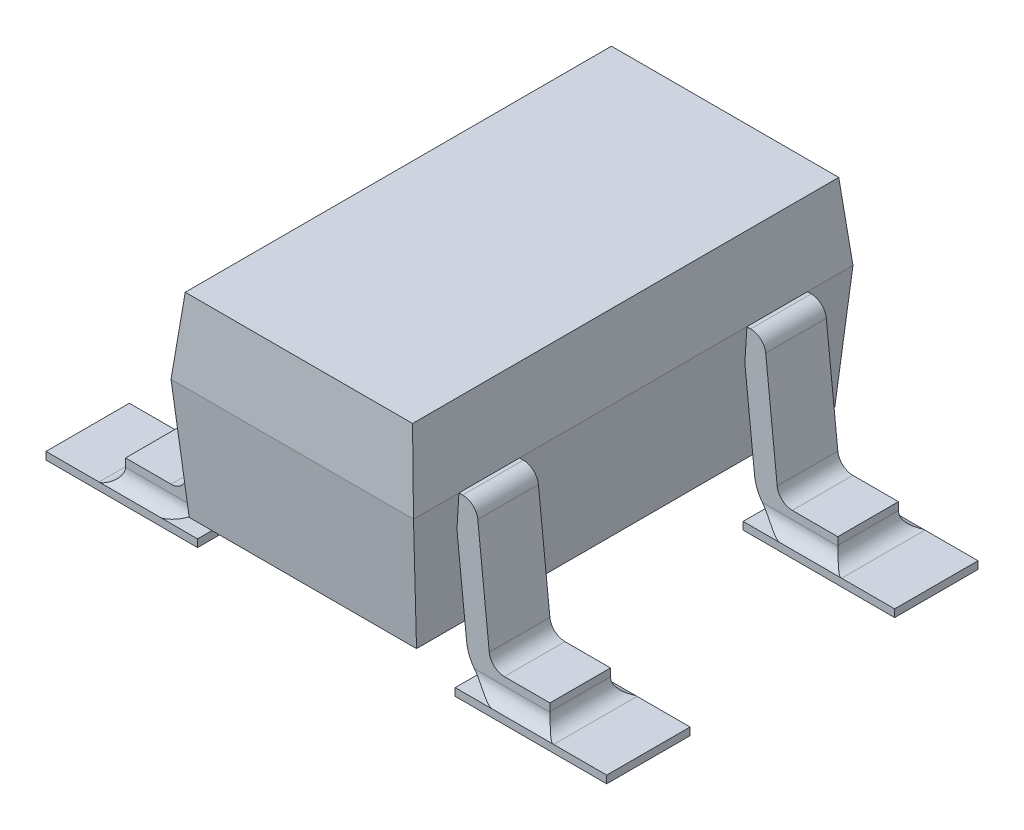
from build123d import *

# Parameters (mm, degrees)
BOSS_EXTRUDE1_DEPTH     = 1.45
CUT_EXTRUDE1_DEPTH      = 3.168524844
CUT_EXTRUDE1_DEPTH_BACK = 3.168524844
EXTRUDE_THIN1_DEPTH     = 0.2
SKETCH5_W               = 1
SKETCH5_H               = 0.55
BOSS_EXTRUDE2_DEPTH     = 0.05
FILLET1_START           = -1.4
FILLET1_DEPTH           = 0.326027692
FILLET1_START_2         = -1.073972308
FILLET1_2_DEPTH         = 0.17209879
FILLET1_START_3         = -1.5000001
FILLET1_3_DEPTH         = 0.1000001
FILLET1_4_DEPTH         = 2
FILLET1_START_4         = 0.75
FILLET1_5_DEPTH         = 0.4
FILLET2_START           = 1.079868081
FILLET2_DEPTH           = 0.320131919
FILLET2_START_2         = 0.901873518
FILLET2_2_DEPTH         = 0.177994563
FILLET2_START_3         = 1.4
FILLET2_3_DEPTH         = 0.1000001
FILLET2_4_DEPTH         = 2
FILLET2_START_4         = 0.75
FILLET2_5_DEPTH         = 0.4
LPATTERN1_COUNT         = 3
LPATTERN1_PITCH         = 0.95
CUT_EXTRUDE2_DEPTH      = 3.735872804
CUT_EXTRUDE2_DEPTH_BACK = 3.735872804
SKETCH6_W               = 1.85
SKETCH6_H               = 0.55
INDENT1_START           = -1.15
INDENT1_DEPTH           = 0.4
INDENT1_START_2         = 0.75
INDENT1_2_DEPTH         = 0.4
INDENT1_START_3         = -0.2
INDENT1_3_DEPTH         = 0.4


with BuildPart() as part:
    # Sketch1 → Boss-Extrude1 (new, symmetric)
    with BuildSketch(Plane.XY):
        Polygon((-0.75, 0.1), (0.75, 0.1), (0.8, 0.9), (0.75, 1.4), (-0.75, 1.4), (-0.8, 0.9), align=None)
    extrude(amount=BOSS_EXTRUDE1_DEPTH, both=True)

    # Sketch3 → Cut-Extrude1 (cut, two sides: drawn at the far end of the back side and taken through both)
    with BuildSketch(Plane(origin=(0, 0, 0), x_dir=(0, 0, -1), z_dir=(1, 0, 0)).offset(-CUT_EXTRUDE1_DEPTH_BACK)):
        Polygon((-1.45, 0.1), (-1.45, 0.9), (-1.380009069, 0.1), align=None)
        Polygon((-1.406255668, 1.4), (-1.45, 1.4), (-1.45, 0.9), align=None)
        Polygon((1.45, 0.9), (1.406255668, 1.4), (1.45, 1.4), align=None)
        Polygon((1.45, 0.9), (1.380009069, 0.1), (1.45, 0.1), align=None)
    extrude(amount=CUT_EXTRUDE1_DEPTH + CUT_EXTRUDE1_DEPTH_BACK, mode=Mode.SUBTRACT)

    # Indent1: read off the stored shape, not the designer's step
    # Indent1 outline → Indent1 (cut)
    with BuildSketch(Plane.XY.offset(INDENT1_START)):
        Polygon((-0.786572435, 0.685158958), (-0.779757367, 0.75), (0.779757367, 0.75), (0.786572435, 0.685158958), (0.8, 0.9), (-0.8, 0.9), align=None)
    extrude(amount=INDENT1_DEPTH, mode=Mode.SUBTRACT)

    # Indent1 2 outline → Indent1 2 (cut)
    with BuildSketch(Plane.XY.offset(INDENT1_START_2)):
        Polygon((-0.786572435, 0.685158958), (-0.779757367, 0.75), (0.779757367, 0.75), (0.786572435, 0.685158958), (0.8, 0.9), (-0.8, 0.9), align=None)
    extrude(amount=INDENT1_2_DEPTH, mode=Mode.SUBTRACT)

    # Indent1 3 outline → Indent1 3 (cut)
    with BuildSketch(Plane.XY.offset(INDENT1_START_3)):
        Polygon((-0.786572435, 0.685158958), (-0.779757367, 0.75), (0, 0.75), (0, 0.9), (-0.8, 0.9), align=None)
    extrude(amount=INDENT1_3_DEPTH, mode=Mode.SUBTRACT)


with BuildPart() as body_2:
    # Sketch4 → Extrude-Thin1 (new, symmetric)
    with BuildSketch(Plane.XY.offset(0.95)):
        with BuildLine():
            Line((-1.4, 0), (-1.09945219, 0))
            ThreePointArc((-1.09945219, 0), (-1.032539129, 0.025685517), (-1, 0.089547154))
            Line((-1, 0.089547154), (-0.924229758, 0.810452846))
            ThreePointArc((-0.924229758, 0.810452846), (-0.89169063, 0.874314483), (-0.824777569, 0.9))
            Line((-0.824777569, 0.9), (0.824777569, 0.9))
            ThreePointArc((0.824777569, 0.9), (0.89169063, 0.874314483), (0.924229758, 0.810452846))
            Line((0.924229758, 0.810452846), (1, 0.089547154))
            ThreePointArc((1, 0.089547154), (1.032539129, 0.025685517), (1.09945219, 0))
            Line((1.09945219, 0), (1.4, 0))
            Line((1.4, 0), (1.4, -0.15))
            Line((1.4, -0.15), (1.09945219, -0.15))
            ThreePointArc((1.09945219, -0.15), (0.932169538, -0.085786206), (0.850821716, 0.073867884))
            Line((0.850821716, 0.073867884), (0.779757367, 0.75))
            Line((0.779757367, 0.75), (-0.779757367, 0.75))
            Line((-0.779757367, 0.75), (-0.850821716, 0.073867884))
            ThreePointArc((-0.850821716, 0.073867884), (-0.932169538, -0.085786206), (-1.09945219, -0.15))
            Line((-1.09945219, -0.15), (-1.4, -0.15))
            Line((-1.4, -0.15), (-1.4, 0))
        make_face()
    extrude(amount=EXTRUDE_THIN1_DEPTH, both=True)

    # Sketch5 → Boss-Extrude2 (add)
    with BuildSketch(Plane.XZ.offset(0.15)):
        with Locations((-1.35, 0.95)):
            Rectangle(SKETCH5_W, SKETCH5_H)
        with Locations((1.35, 0.95)):
            Rectangle(SKETCH5_W, SKETCH5_H)
    extrude(amount=BOSS_EXTRUDE2_DEPTH)

    # Fillet1: read off the stored shape, not the designer's step
    # Fillet1 outline → Fillet1 (add)
    with BuildSketch(Plane.YZ.offset(FILLET1_START)):
        with BuildLine():
            Line((-0.053175416, 0.75), (-0.15, 0.75))
            Line((-0.15, 0.75), (-0.15000146, 0.674994344))
            ThreePointArc((-0.15000146, 0.674994344), (-0.114414969, 0.729055153), (-0.053175416, 0.75))
        make_face()
        with BuildLine():
            ThreePointArc((-0.053175416, 1.15), (-0.114414364, 1.170944378), (-0.150001077, 1.225004173))
            Line((-0.150001077, 1.225004173), (-0.15, 1.15))
            Line((-0.15, 1.15), (-0.053175416, 1.15))
        make_face()
    extrude(amount=FILLET1_DEPTH)

    # Fillet1 2 outline → Fillet1 2 (add)
    with BuildSketch(Plane.YZ.offset(FILLET1_START_2)):
        with BuildLine():
            ThreePointArc((-0.053175416, 1.15), (-0.114414364, 1.170944378), (-0.150001077, 1.225004173))
            Line((-0.150001077, 1.225004173), (-0.15, 1.15))
            Line((-0.15, 1.15), (-0.053175416, 1.15))
        make_face()
        with BuildLine():
            Line((-0.053175416, 0.75), (-0.15, 0.75))
            Line((-0.15, 0.75), (-0.15000146, 0.674994344))
            ThreePointArc((-0.15000146, 0.674994344), (-0.114414969, 0.729055153), (-0.053175416, 0.75))
        make_face()
    extrude(amount=FILLET1_2_DEPTH)

    # Fillet1 3 outline → Fillet1 3 (add)
    with BuildSketch(Plane.YZ.offset(FILLET1_START_3)):
        with BuildLine():
            ThreePointArc((-0.053175416, 1.15), (-0.114414364, 1.170944378), (-0.150001077, 1.225004173))
            Line((-0.150001077, 1.225004173), (-0.15, 1.15))
            Line((-0.15, 1.15), (-0.053175416, 1.15))
        make_face()
        with BuildLine():
            Line((-0.053175416, 0.75), (-0.15, 0.75))
            Line((-0.15, 0.75), (-0.15000146, 0.674994344))
            ThreePointArc((-0.15000146, 0.674994344), (-0.114414969, 0.729055153), (-0.053175416, 0.75))
        make_face()
    extrude(amount=FILLET1_3_DEPTH)

    # Fillet1 4 outline → Fillet1 4 (cut)
    with BuildSketch(Plane.XY):
        with BuildLine():
            ThreePointArc((-0.901873581, -0.053175367), (-0.989438195, -0.124492585), (-1.09945219, -0.15))
            Line((-1.09945219, -0.15), (-0.901873518, -0.15))
            Line((-0.901873518, -0.15), (-0.901873581, -0.053175367))
        make_face()
        with BuildLine():
            Line((-1.4, 0), (-1.399999996, 1))
            Line((-1.399999996, 1), (-3, 1))
            Line((-3, 1), (-3, -0.15))
            Line((-3, -0.15), (-1.5, -0.15))
            ThreePointArc((-1.5, -0.15), (-1.429289322, -0.120710678), (-1.4, -0.05))
            Line((-1.4, -0.05), (-1.4, 0))
        make_face()
    extrude(amount=FILLET1_4_DEPTH, mode=Mode.SUBTRACT)

    # Fillet1 5 outline → Fillet1 5 (add)
    with BuildSketch(Plane.XY.offset(FILLET1_START_4)):
        with BuildLine():
            Line((-1.4, -0.15), (-1.4, -0.05))
            ThreePointArc((-1.4, -0.05), (-1.429289322, -0.120710678), (-1.5, -0.15))
            Line((-1.5, -0.15), (-1.4, -0.15))
        make_face()
    extrude(amount=FILLET1_5_DEPTH)

    # Fillet2: read off the stored shape, not the designer's step
    # Fillet2 outline → Fillet2 (add)
    with BuildSketch(Plane.YZ.offset(FILLET2_START)):
        with BuildLine():
            Line((-0.053175416, 0.75), (-0.15, 0.75))
            Line((-0.15, 0.75), (-0.150001117, 0.674995674))
            ThreePointArc((-0.150001117, 0.674995674), (-0.114414426, 0.729055574), (-0.053175416, 0.75))
        make_face()
        with BuildLine():
            ThreePointArc((-0.053175416, 1.15), (-0.114414969, 1.170944847), (-0.15000146, 1.225005656))
            Line((-0.15000146, 1.225005656), (-0.15, 1.15))
            Line((-0.15, 1.15), (-0.053175416, 1.15))
        make_face()
    extrude(amount=FILLET2_DEPTH)

    # Fillet2 2 outline → Fillet2 2 (add)
    with BuildSketch(Plane.YZ.offset(FILLET2_START_2)):
        with BuildLine():
            Line((-0.053175416, 0.75), (-0.15, 0.75))
            Line((-0.15, 0.75), (-0.150001117, 0.674995674))
            ThreePointArc((-0.150001117, 0.674995674), (-0.114414426, 0.729055574), (-0.053175416, 0.75))
        make_face()
        with BuildLine():
            ThreePointArc((-0.053175416, 1.15), (-0.114414969, 1.170944847), (-0.15000146, 1.225005656))
            Line((-0.15000146, 1.225005656), (-0.15, 1.15))
            Line((-0.15, 1.15), (-0.053175416, 1.15))
        make_face()
    extrude(amount=FILLET2_2_DEPTH)

    # Fillet2 3 outline → Fillet2 3 (add)
    with BuildSketch(Plane.YZ.offset(FILLET2_START_3)):
        with BuildLine():
            Line((-0.053175416, 0.75), (-0.15, 0.75))
            Line((-0.15, 0.75), (-0.150001117, 0.674995674))
            ThreePointArc((-0.150001117, 0.674995674), (-0.114414426, 0.729055574), (-0.053175416, 0.75))
        make_face()
        with BuildLine():
            ThreePointArc((-0.053175416, 1.15), (-0.114414969, 1.170944847), (-0.15000146, 1.225005656))
            Line((-0.15000146, 1.225005656), (-0.15, 1.15))
            Line((-0.15, 1.15), (-0.053175416, 1.15))
        make_face()
    extrude(amount=FILLET2_3_DEPTH)

    # Fillet2 4 outline → Fillet2 4 (cut)
    with BuildSketch(Plane.XY):
        with BuildLine():
            Line((0.901873581, -0.053175367), (0.901873518, -0.15))
            Line((0.901873518, -0.15), (1.09945219, -0.15))
            ThreePointArc((1.09945219, -0.15), (0.989438195, -0.124492585), (0.901873581, -0.053175367))
        make_face()
        with BuildLine():
            Line((3, 1), (1.399999998, 1))
            Line((1.399999998, 1), (1.4, 0))
            Line((1.4, 0), (1.4, -0.05))
            ThreePointArc((1.4, -0.05), (1.429289322, -0.120710678), (1.5, -0.15))
            Line((1.5, -0.15), (3, -0.15))
            Line((3, -0.15), (3, 1))
        make_face()
    extrude(amount=FILLET2_4_DEPTH, mode=Mode.SUBTRACT)

    # Fillet2 5 outline → Fillet2 5 (add)
    with BuildSketch(Plane.XY.offset(FILLET2_START_4)):
        with BuildLine():
            ThreePointArc((1.5, -0.15), (1.429289322, -0.120710678), (1.4, -0.05))
            Line((1.4, -0.05), (1.4, -0.15))
            Line((1.4, -0.15), (1.5, -0.15))
        make_face()
    extrude(amount=FILLET2_5_DEPTH)


with BuildPart() as lpattern1_1:
    # LPattern1: pattern copy
    add(body_2.part.moved(Location(Vector(0, 0, -1) * (1 * LPATTERN1_PITCH))))

    # Sketch6 → Cut-Extrude2 (cut, two sides: drawn at the far end of the back side and taken through both)
    with BuildSketch(Plane(origin=(0, 0, 0), x_dir=(1, 0, 0), z_dir=(0, 1, 0)).offset(-CUT_EXTRUDE2_DEPTH_BACK)):
        with Locations((0.925, 0)):
            Rectangle(SKETCH6_W, SKETCH6_H)
    extrude(amount=CUT_EXTRUDE2_DEPTH + CUT_EXTRUDE2_DEPTH_BACK, mode=Mode.SUBTRACT)


with BuildPart() as lpattern1_2:
    # LPattern1: pattern copy
    add(body_2.part.moved(Location(Vector(0, 0, -1) * (2 * LPATTERN1_PITCH))))


with BuildPart() as cut_extrude2_kept_piece:
    # of the separate pieces the step leaves, the one the design keeps (cut_extrude2_pieces_kept)
    add(lpattern1_1.part.solids().sort_by_distance((-1.85, -0.15, 0.275))[0])


solid = Compound([part.part, body_2.part, lpattern1_2.part, cut_extrude2_kept_piece.part])
